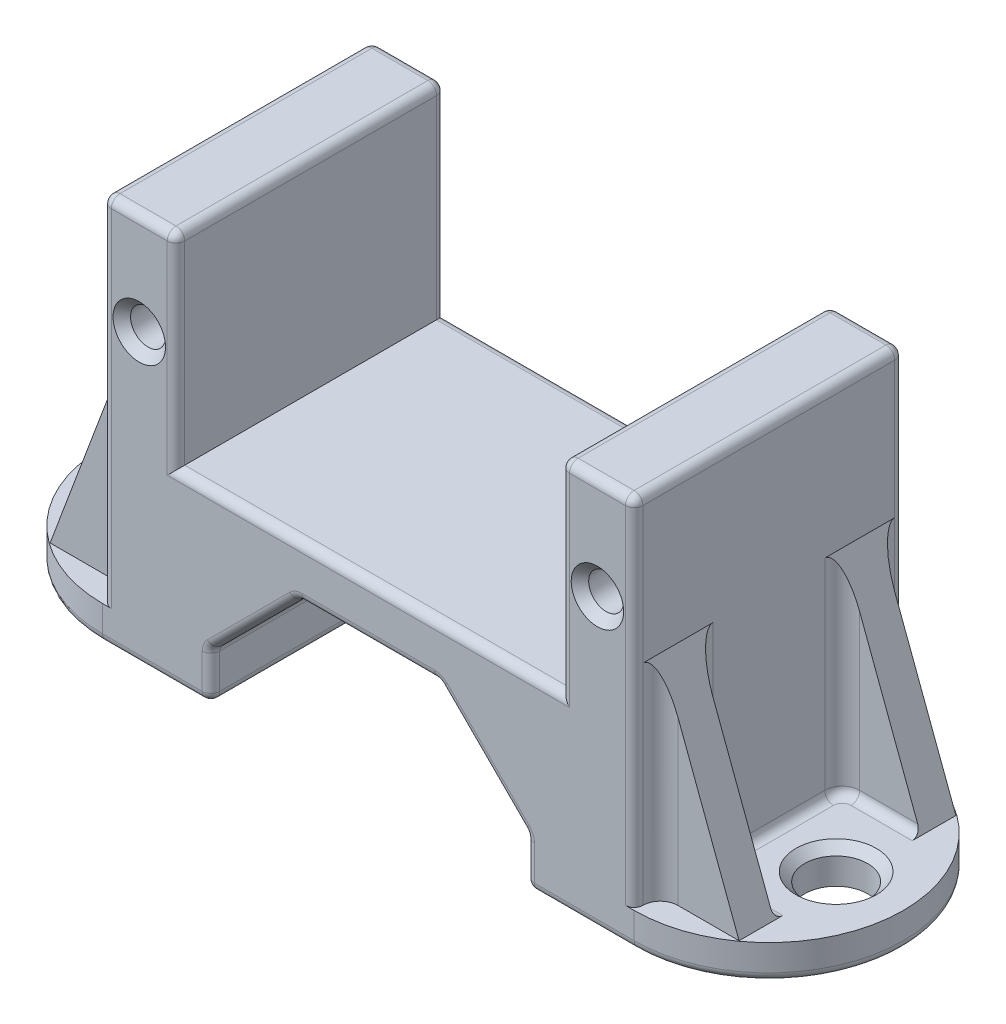
from build123d import *

# Parameters (mm, degrees)
SKETCH1_W               = 22
SKETCH1_H               = 15.4
BOSS_EXTRUDE1_DEPTH     = 5.35
SKETCH3_W               = 18
SKETCH3_H               = 11.4
CUT_EXTRUDE2_DEPTH      = 7.7
CUT_EXTRUDE3_DEPTH      = 15.453805727
CUT_EXTRUDE3_DEPTH_BACK = 15.453805727
SKETCH8_W               = 18
SKETCH8_H               = 7.7
SKETCH2_W               = 15.4
SKETCH2_H               = 22.3
BOSS_EXTRUDE2_DEPTH     = 4.2
SKETCH4_R               = 1.8
BOSS_EXTRUDE4_DEPTH     = 2
RIB9_REACH              = 33.275
SKETCH7_WALL_W          = 77.365905698
SKETCH7_WALL_H          = 2
MIRROR4_COPY_1_REACH    = 33.275
MIRROR4_COPY_1_SKETCH_W = 77.365905698
MIRROR4_COPY_1_SKETCH_H = 2
CHAMFER1_SIZE           = 5
FILLET2_R               = 1
FILLET5_R               = 0.5
CUT_EXTRUDE5_DEPTH      = 30.512751481
CUT_EXTRUDE5_DEPTH_BACK = 30.512751481
SKETCH10_R              = 1
CHAMFER4_SIZE           = 0.5


with BuildPart() as part:
    # Sketch1 → Boss-Extrude1 (new, symmetric)
    with BuildSketch(Plane(origin=(0, 0, 0), x_dir=(1, 0, 0), z_dir=(0, 1, 0))):
        Rectangle(SKETCH1_W, SKETCH1_H)
    extrude(amount=BOSS_EXTRUDE1_DEPTH, both=True)

    # Sketch3 → Cut-Extrude2 (cut)
    with BuildSketch(Plane.XZ.offset(5.35)):
        Rectangle(SKETCH3_W, SKETCH3_H)
    extrude(amount=-CUT_EXTRUDE2_DEPTH, mode=Mode.SUBTRACT)

    # Sketch8 → Cut-Extrude3 (cut, two sides: drawn at the far end of the back side and taken through both)
    with BuildSketch(Plane.XY.offset(-CUT_EXTRUDE3_DEPTH_BACK)):
        with Locations((0, -1.5)):
            Rectangle(SKETCH8_W, SKETCH8_H)
    extrude(amount=CUT_EXTRUDE3_DEPTH + CUT_EXTRUDE3_DEPTH_BACK, mode=Mode.SUBTRACT)

    # Sketch2 → Boss-Extrude2 (add)
    with BuildSketch(Plane.ZY.offset(11)):
        with Locations((0, 5.8)):
            Rectangle(SKETCH2_W, SKETCH2_H)
    boss_extrude2 = extrude(amount=BOSS_EXTRUDE2_DEPTH)

    # Mirror1: Boss-Extrude2 across plane
    add(boss_extrude2.mirror(Plane(origin=(0, 0, 0), x_dir=(0, 0, 1), z_dir=(1, 0, 0))))

    # Sketch4 → Boss-Extrude4 (add)
    with BuildSketch(Plane.XZ.offset(5.35)):
        with BuildLine():
            Line((-15.2, -7.7), (-15.2, 7.7))
            ThreePointArc((-15.2, 7.7), (-22.9, 0), (-15.2, -7.7))
        make_face()
        with Locations(Location((-19.05, 0, 0), (0, 0, 270))):
            Circle(SKETCH4_R, mode=Mode.SUBTRACT)
    boss_extrude4 = extrude(amount=-BOSS_EXTRUDE4_DEPTH)

    # Sketch7 wall → Rib9 (add, up to next)
    with BuildSketch(Plane(origin=(-17.45, 2.65, 5.2), x_dir=(0.351123441588, 0.936329177569, 0), z_dir=(-0.936329177569, 0.351123441588, 0)), mode=Mode.PRIVATE) as rib9_sk1:
        Rectangle(SKETCH7_WALL_W, SKETCH7_WALL_H)
    rib9_tool1 = extrude(rib9_sk1.sketch, amount=-RIB9_REACH, mode=Mode.PRIVATE) - part.part
    rib9 = rib9_tool1.solids().sort_by_distance((-17.45, 2.65, 5.2))[0]
    add(rib9)

    # Mirror3: Rib9 across plane
    add(rib9.mirror(Plane.XY))

    # Mirror4: Boss-Extrude4, Rib9 across plane
    add(boss_extrude4.mirror(Plane(origin=(0, 0, 0), x_dir=(0, 0, 1), z_dir=(1, 0, 0))))
    add(rib9.mirror(Plane(origin=(0, 0, 0), x_dir=(0, 0, 1), z_dir=(1, 0, 0))))

    # Mirror4 copy 1 sketch → Mirror4 copy 1 (add, up to next)
    with BuildSketch(Plane(origin=(17.45, 2.65, -5.2), x_dir=(-0.351123441588, 0.936329177569, 0), z_dir=(0.936329177569, 0.351123441588, 0)), mode=Mode.PRIVATE) as mirror4_copy_1_sk1:
        Rectangle(MIRROR4_COPY_1_SKETCH_W, MIRROR4_COPY_1_SKETCH_H)
    mirror4_copy_1_tool1 = extrude(mirror4_copy_1_sk1.sketch, amount=-MIRROR4_COPY_1_REACH, mode=Mode.PRIVATE) - part.part
    add(mirror4_copy_1_tool1.solids().sort_by_distance((17.45, 2.65, -5.2))[0])

    # Chamfer1
    chamfer1_edges = [part.edges().sort_by_distance(p)[0] for p in [
        (-9, 2.35, 0),
        (9, 2.35, 0),
    ]]
    chamfer(chamfer1_edges, length=CHAMFER1_SIZE)

    # Fillet2
    fillet2_edges = [part.edges().sort_by_distance(p)[0] for p in [
        (-15.2, 2.65, 4.2),
        (-15.2, 2.65, 6.2),
        (-15.2, 2.65, -4.2),
        (-15.2, 2.65, -6.2),
        (15.2, 2.65, 4.2),
        (15.2, 2.65, 6.2),
        (15.2, 2.65, -4.2),
        (15.2, 2.65, -6.2),
    ]]
    fillet(fillet2_edges, radius=FILLET2_R)

    # Fillet5
    fillet5_edges = [part.edges().sort_by_distance(p)[0] for p in [
        (-17.95, -3.35, -4.2),
        (-9, -5.35, 0),
        (0, 5.35, -7.7),
        (9, -5.35, 0),
        (15.2, 6.8, 7.7),
        (15.2, -3.35, 0),
        (22.9, -5.35, 0),
        (17.95, -3.35, 4.2),
        (-12.1, -5.35, -7.7),
        (12.1, -5.35, 7.7),
        (0, 2.35, 7.7),
        (0, 2.35, -7.7),
        (4, 2.35, 0),
        (-4, 2.35, 0),
        (-9, -4, -7.7),
        (-9, -4, 7.7),
        (-9, -2.65, 0),
        (9, -2.65, 0),
        (-6.5, -0.15, -7.7),
        (-6.5, -0.15, 7.7),
        (6.5, -0.15, 7.7),
        (6.5, -0.15, -7.7),
        (17.95, -3.35, -4.2),
        (15.492893219, -3.35, 3.907106781),
        (15.492893219, -3.35, -3.907106781),
        (-17.95, -3.35, 4.2),
        (-15.2, -3.35, 0),
        (-15.492893219, -3.35, -3.907106781),
        (-15.492893219, -3.35, 3.907106781),
        (9, -4, -7.7),
        (9, -4, 7.7),
        (12.1, -5.35, -7.7),
        (-11, 11.15, -7.7),
        (-13.1, 16.95, -7.7),
        (-11, 11.15, 7.7),
        (-11, 16.95, 0),
        (-13.1, 16.95, 7.7),
        (-15.2, 6.8, -7.7),
        (-15.2, 16.95, 0),
        (-12.1, -5.35, 7.7),
        (11, 11.15, 7.7),
        (11, 16.95, 0),
        (11, 11.15, -7.7),
        (15.2, 6.8, -7.7),
        (15.2, 16.95, 0),
        (13.1, 16.95, -7.7),
        (13.1, 16.95, 7.7),
        (-15.2, 6.8, 7.7),
        (-22.9, -5.35, 0),
        (0, 5.35, 7.7),
    ]]
    fillet(fillet5_edges, radius=FILLET5_R - 0.0001)  # a hair under: the kernel refuses the full size

    # Sketch10 → Cut-Extrude5 (cut, two sides: drawn at the far end of the back side and taken through both)
    with BuildSketch(Plane.XY.offset(-CUT_EXTRUDE5_DEPTH_BACK)):
        with Locations((-13.1, 11.15)):
            Circle(SKETCH10_R)
        with Locations((13.1, 11.15)):
            Circle(SKETCH10_R)
    extrude(amount=CUT_EXTRUDE5_DEPTH + CUT_EXTRUDE5_DEPTH_BACK, mode=Mode.SUBTRACT)

    # Chamfer4
    chamfer4_edges = [part.edges().sort_by_distance(p)[0] for p in [
        (19.05, -3.35, 1.8),
        (-14.1, 11.15, -7.7),
        (-14.1, 11.15, 7.7),
        (12.1, 11.15, -7.7),
        (12.1, 11.15, 7.7),
        (-19.05, -3.35, 1.8),
    ]]
    chamfer(chamfer4_edges, length=CHAMFER4_SIZE)


solid = part.part
